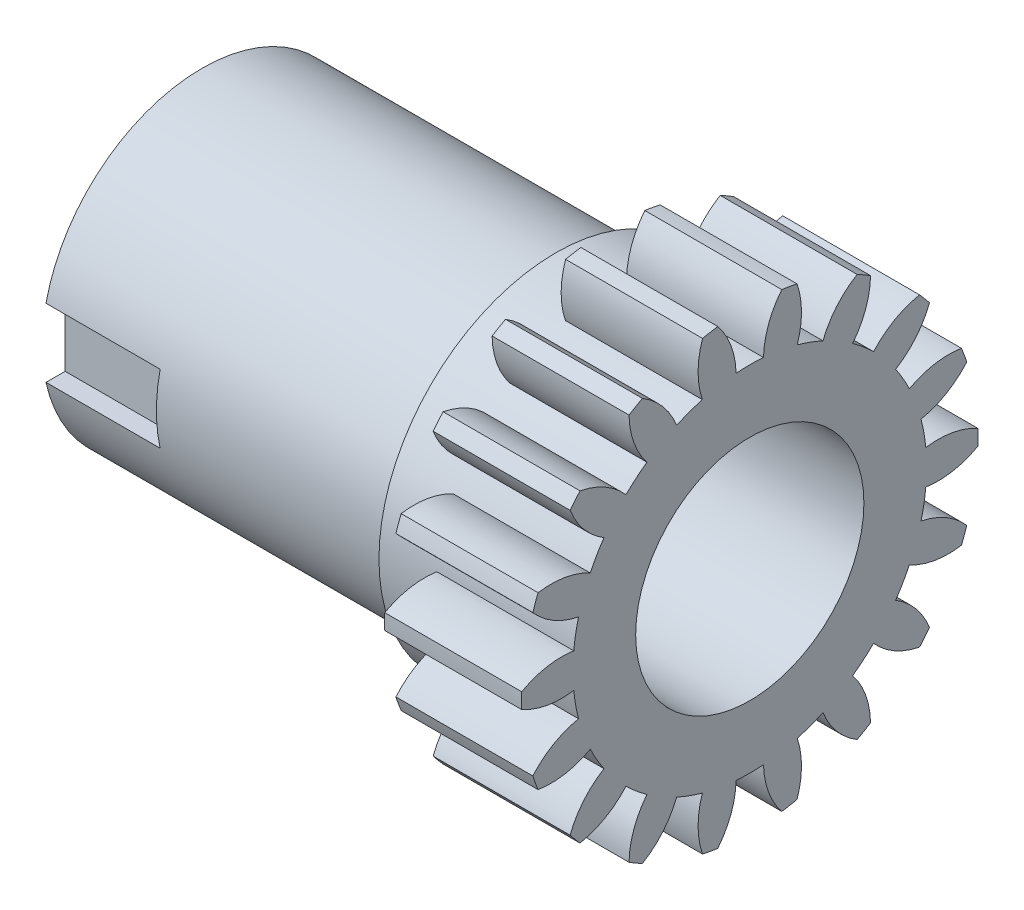
from build123d import *

# Parameters (mm, degrees)
SPUR_START                = -38.37009116
SPUR_GEAR_ISO_OUTLINE_R   = 7
SPUR_GEAR_ISO_OUTLINE_R_2 = 5
SPUR_GEAR_ISO_DEPTH       = 24.0000508
SPUR_START_2              = -20.37004036
SPUR_GEAR_ISO_2_OUTLINE_R = 7
SPUR_GEAR_ISO_2_DEPTH     = 6
CUT_EXTRUDE1_DEPTH        = 5
BOSS_EXTRUDE1_START       = 2.5
SKETCH2_R                 = 7.749
SKETCH2_R_2               = 7
BOSS_EXTRUDE1_DEPTH       = 2.5


# Read off the part's stored shape, not the designer's step: spur gear_iso
with BuildPart() as part:
    # spur gear_iso outline → spur gear_iso (new body)
    with BuildSketch(Plane.YZ.offset(SPUR_START)):
        with Locations((4.178828844, 7.909958029)):
            Circle(SPUR_GEAR_ISO_OUTLINE_R)
        with Locations((4.178828844, 7.909958029)):
            Circle(SPUR_GEAR_ISO_OUTLINE_R_2, mode=Mode.SUBTRACT)
    extrude(amount=SPUR_GEAR_ISO_DEPTH)

    # spur gear_iso 2 outline → spur gear_iso 2 (add)
    with BuildSketch(Plane.YZ.offset(SPUR_START_2)):
        with BuildLine():
            ThreePointArc((10.863081906, 15.347750779), (10.606704941, 15.57040246), (10.342916446, 15.784221425))
            ThreePointArc((10.342916446, 15.784221425), (9.329220993, 15.189966754), (8.560887593, 14.300933081))
            ThreePointArc((8.560887593, 14.300933081), (8.053328844, 14.620788883), (7.522546219, 14.900419753))
            ThreePointArc((7.522546219, 14.900419753), (7.908305264, 16.010332833), (7.916097179, 17.185346182))
            ThreePointArc((7.916097179, 17.185346182), (7.599030277, 17.306884237), (7.278019782, 17.417587362))
            ThreePointArc((7.278019782, 17.417587362), (6.528704713, 16.512466369), (6.110774911, 15.414262487))
            ThreePointArc((6.110774911, 15.414262487), (5.524428573, 15.541233307), (4.930016667, 15.622462023))
            ThreePointArc((4.930016667, 15.622462023), (4.912898964, 16.797376517), (4.518342735, 17.904192883))
            ThreePointArc((4.518342735, 17.904192883), (4.178828843, 17.909958029), (3.839314952, 17.904192883))
            ThreePointArc((3.839314952, 17.904192883), (3.444758723, 16.797376517), (3.427641021, 15.622462023))
            ThreePointArc((3.427641021, 15.622462023), (2.833229115, 15.541233307), (2.246882776, 15.414262487))
            ThreePointArc((2.246882776, 15.414262487), (1.828952974, 16.512466369), (1.079637905, 17.417587362))
            ThreePointArc((1.079637905, 17.417587362), (0.75862741, 17.306884237), (0.441560508, 17.185346182))
            ThreePointArc((0.441560508, 17.185346182), (0.449352423, 16.010332833), (0.835111468, 14.900419753))
            ThreePointArc((0.835111468, 14.900419753), (0.304328844, 14.620788883), (-0.203229906, 14.300933081))
            ThreePointArc((-0.203229906, 14.300933081), (-0.971563306, 15.189966754), (-1.985258759, 15.784221425))
            ThreePointArc((-1.985258759, 15.784221425), (-2.249047253, 15.57040246), (-2.505424219, 15.347750779))
            ThreePointArc((-2.505424219, 15.347750779), (-2.09622398, 14.246264397), (-1.354116421, 13.335224631))
            ThreePointArc((-1.354116421, 13.335224631), (-1.757249546, 12.890919217), (-2.12480163, 12.416757764))
            ThreePointArc((-2.12480163, 12.416757764), (-3.150866281, 12.989390646), (-4.306675485, 13.201103111))
            ThreePointArc((-4.306675485, 13.201103111), (-4.481425194, 12.909958029), (-4.646189377, 12.613047801))
            ThreePointArc((-4.646189377, 12.613047801), (-3.884936401, 11.717943901), (-2.875989453, 11.115662288))
            ThreePointArc((-2.875989453, 11.115662288), (-3.102849275, 10.56027212), (-3.286062488, 9.988995885))
            ThreePointArc((-3.286062488, 9.988995885), (-4.446099849, 10.17616), (-5.604615157, 9.979794611))
            ThreePointArc((-5.604615157, 9.979794611), (-5.669248686, 9.646439806), (-5.722527095, 9.311082786))
            ThreePointArc((-5.722527095, 9.311082786), (-4.701039727, 8.730324108), (-3.546947281, 8.509444701))
            ThreePointArc((-3.546947281, 8.509444701), (-3.570171156, 7.909958029), (-3.546947281, 7.310471357))
            ThreePointArc((-3.546947281, 7.310471357), (-4.701039727, 7.089591951), (-5.722527095, 6.508833272))
            ThreePointArc((-5.722527095, 6.508833272), (-5.669248686, 6.173476252), (-5.604615157, 5.840121447))
            ThreePointArc((-5.604615157, 5.840121447), (-4.446099849, 5.643756058), (-3.286062488, 5.830920173))
            ThreePointArc((-3.286062488, 5.830920173), (-3.102849275, 5.259643938), (-2.875989453, 4.70425377))
            ThreePointArc((-2.875989453, 4.70425377), (-3.884936402, 4.101972158), (-4.646189377, 3.206868257))
            ThreePointArc((-4.646189377, 3.206868257), (-4.481425194, 2.909958029), (-4.306675485, 2.618812947))
            ThreePointArc((-4.306675485, 2.618812947), (-3.15086628, 2.830525412), (-2.12480163, 3.403158295))
            ThreePointArc((-2.12480163, 3.403158295), (-1.757249546, 2.928996842), (-1.354116421, 2.484691427))
            ThreePointArc((-1.354116421, 2.484691427), (-2.09622398, 1.573651661), (-2.505424219, 0.472165279))
            ThreePointArc((-2.505424219, 0.472165279), (-2.249047253, 0.249513598), (-1.985258759, 0.035694633))
            ThreePointArc((-1.985258759, 0.035694633), (-0.971563306, 0.629949304), (-0.203229906, 1.518982977))
            ThreePointArc((-0.203229906, 1.518982977), (0.304328844, 1.199127175), (0.835111468, 0.919496305))
            ThreePointArc((0.835111468, 0.919496305), (0.449352423, -0.190416775), (0.441560508, -1.365430124))
            ThreePointArc((0.441560508, -1.365430124), (0.75862741, -1.486968179), (1.079637905, -1.597671303))
            ThreePointArc((1.079637905, -1.597671303), (1.828952974, -0.69255031), (2.246882776, 0.405653572))
            ThreePointArc((2.246882776, 0.405653572), (2.833229115, 0.278682751), (3.427641021, 0.197454035))
            ThreePointArc((3.427641021, 0.197454035), (3.444758723, -0.977460459), (3.839314952, -2.084276825))
            ThreePointArc((3.839314952, -2.084276825), (4.178828843, -2.090041971), (4.518342735, -2.084276825))
            ThreePointArc((4.518342735, -2.084276825), (4.912898964, -0.977460459), (4.930016667, 0.197454035))
            ThreePointArc((4.930016667, 0.197454035), (5.524428573, 0.278682751), (6.110774911, 0.405653572))
            ThreePointArc((6.110774911, 0.405653572), (6.528704713, -0.69255031), (7.278019782, -1.597671303))
            ThreePointArc((7.278019782, -1.597671303), (7.599030277, -1.486968179), (7.916097179, -1.365430124))
            ThreePointArc((7.916097179, -1.365430124), (7.908305264, -0.190416775), (7.522546219, 0.919496305))
            ThreePointArc((7.522546219, 0.919496305), (8.053328844, 1.199127175), (8.560887593, 1.518982977))
            ThreePointArc((8.560887593, 1.518982977), (9.329220993, 0.629949304), (10.342916446, 0.035694633))
            ThreePointArc((10.342916446, 0.035694633), (10.606704941, 0.249513598), (10.863081906, 0.472165279))
            ThreePointArc((10.863081906, 0.472165279), (10.453881667, 1.573651661), (9.711774108, 2.484691427))
            ThreePointArc((9.711774108, 2.484691427), (10.114907233, 2.928996842), (10.482459318, 3.403158295))
            ThreePointArc((10.482459318, 3.403158295), (11.508523968, 2.830525412), (12.664333173, 2.618812947))
            ThreePointArc((12.664333173, 2.618812947), (12.839082882, 2.909958029), (13.003847064, 3.206868257))
            ThreePointArc((13.003847064, 3.206868257), (12.242594089, 4.101972158), (11.233647141, 4.70425377))
            ThreePointArc((11.233647141, 4.70425377), (11.460506962, 5.259643939), (11.643720175, 5.830920173))
            ThreePointArc((11.643720175, 5.830920173), (12.803757537, 5.643756058), (13.962272845, 5.840121447))
            ThreePointArc((13.962272845, 5.840121447), (14.026906374, 6.173476252), (14.080184782, 6.508833272))
            ThreePointArc((14.080184782, 6.508833272), (13.058697415, 7.089591951), (11.904604969, 7.310471357))
            ThreePointArc((11.904604969, 7.310471357), (11.927828844, 7.909958029), (11.904604969, 8.509444701))
            ThreePointArc((11.904604969, 8.509444701), (13.058697414, 8.730324108), (14.080184782, 9.311082786))
            ThreePointArc((14.080184782, 9.311082786), (14.026906374, 9.646439806), (13.962272845, 9.979794611))
            ThreePointArc((13.962272845, 9.979794611), (12.803757537, 10.17616), (11.643720175, 9.988995885))
            ThreePointArc((11.643720175, 9.988995885), (11.460506962, 10.56027212), (11.233647141, 11.115662288))
            ThreePointArc((11.233647141, 11.115662288), (12.242594089, 11.717943901), (13.003847064, 12.613047801))
            ThreePointArc((13.003847064, 12.613047801), (12.839082882, 12.909958029), (12.664333173, 13.201103111))
            ThreePointArc((12.664333173, 13.201103111), (11.508523969, 12.989390646), (10.482459318, 12.416757764))
            ThreePointArc((10.482459318, 12.416757764), (10.114907233, 12.890919217), (9.711774108, 13.335224631))
            ThreePointArc((9.711774108, 13.335224631), (10.453881667, 14.246264397), (10.863081906, 15.347750779))
        make_face()
        with Locations((4.178828844, 7.909958029)):
            Circle(SPUR_GEAR_ISO_2_OUTLINE_R, mode=Mode.SUBTRACT)
    extrude(amount=SPUR_GEAR_ISO_2_DEPTH)

    # Sketch1 → Cut-Extrude1 (cut)
    with BuildSketch(Plane.ZY.offset(38.37009116)):
        with BuildLine():
            ThreePointArc((1.072560864, 5.678828844), (0.909958029, 4.178828844), (1.072560864, 2.678828844))
            Line((1.072560864, 2.678828844), (1.909958029, 2.678828844))
            Line((1.909958029, 2.678828844), (1.909958029, 5.678828844))
            Line((1.909958029, 5.678828844), (1.072560864, 5.678828844))
        make_face()
        with BuildLine():
            Line((13.909958029, 2.678828844), (14.747355195, 2.678828844))
            ThreePointArc((14.747355195, 2.678828844), (14.869188596, 3.4244351), (14.909958029, 4.178828844))
            ThreePointArc((14.909958029, 4.178828844), (14.869188596, 4.933222587), (14.747355195, 5.678828844))
            Line((14.747355195, 5.678828844), (13.909958029, 5.678828844))
            Line((13.909958029, 5.678828844), (13.909958029, 2.678828844))
        make_face()
    extrude(amount=-CUT_EXTRUDE1_DEPTH, mode=Mode.SUBTRACT)

    # Sketch2 → Boss-Extrude1 (add)
    with BuildSketch(Plane.ZY.offset(20.37004036).offset(BOSS_EXTRUDE1_START)):
        with Locations((7.909958029, 4.178828844)):
            Circle(SKETCH2_R)
        with Locations(Location((7.909958029, 4.178828844, 0), (0, 0, 192.373625116))):
            Circle(SKETCH2_R_2, mode=Mode.SUBTRACT)
    extrude(amount=-BOSS_EXTRUDE1_DEPTH)


solid = part.part
